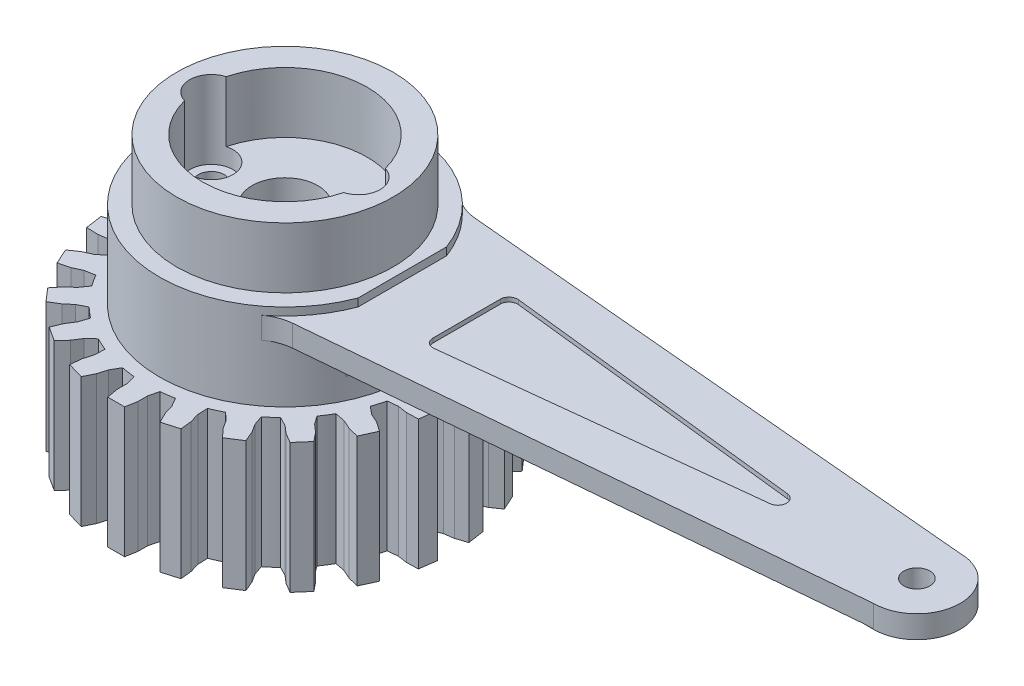
from build123d import *

# Parameters (mm, degrees)
SKETCH1_R            = 14.5
BOSS_EXTRUDE1_DEPTH  = 2
SKETCH2_R            = 3.8
SKETCH2_R_2          = 1.5
CUT_EXTRUDE1_DEPTH   = 2.5
BOSS_EXTRUDE2_START  = 7
SKETCH3_R            = 14.5
SKETCH3_R_2          = 12.5
BOSS_EXTRUDE2_DEPTH  = 7
BOSS_EXTRUDE3_START  = 1
SKETCH4_R            = 14.5
SKETCH4_R_2          = 3.8
SKETCH4_R_3          = 1.5
BOSS_EXTRUDE3_DEPTH  = 1
SKETCH5_R            = 2.6
SKETCH5_R_2          = 2.5
CUT_EXTRUDE2_DEPTH   = 2
BOSS_EXTRUDE4_START  = -3.5
SKETCH6_R            = 1.5
BOSS_EXTRUDE4_DEPTH  = 3.5
BOSS_EXTRUDE5_START  = 30
SKETCH9_R            = 12.5
BOSS_EXTRUDE5_DEPTH  = 30
SKETCH15_R           = 12.5
SKETCH15_R_2         = 9.5
BOSS_EXTRUDE9_DEPTH  = 7
SKETCH17_R           = 2.5
CUT_EXTRUDE5_DEPTH   = 7
SKETCH18_W           = 71.644805376
SKETCH18_H           = 13.532805393
CUT_EXTRUDE6_DEPTH   = 0.9
SKETCH19_W           = 61.579455678
SKETCH19_H           = 54.934190677
CUT_EXTRUDE7_DEPTH   = 15
BOSS_EXTRUDE14_START = -2.5
BOSS_EXTRUDE14_DEPTH = 2.5
FILLET2_R            = 5
SKETCH21_W           = 41.145247831
SKETCH21_H           = 10
BOSS_EXTRUDE15_DEPTH = 4
CUT_EXTRUDE8_DEPTH   = 17
FILLET5_R            = 2
CUT_EXTRUDE9_DEPTH   = 0.5
FILLET6_R            = 1


with BuildPart() as part:
    # Sketch1 → Boss-Extrude1 (new body)
    with BuildSketch(Plane(origin=(0, 0, 0), x_dir=(1, 0, 0), z_dir=(0, 1, 0))):
        Circle(SKETCH1_R)
    extrude(amount=BOSS_EXTRUDE1_DEPTH)

    # Sketch2 → Cut-Extrude1 (cut)
    with BuildSketch(Plane(origin=(0, 2, 0), x_dir=(1, 0, 0), z_dir=(0, 1, 0))):
        Circle(SKETCH2_R)
        with Locations((-8.5, 0)):
            Circle(SKETCH2_R_2)
        with Locations((8.5, 0)):
            Circle(SKETCH2_R_2)
    extrude(amount=-CUT_EXTRUDE1_DEPTH, mode=Mode.SUBTRACT)

    # Sketch3 → Boss-Extrude2 (add)
    with BuildSketch(Plane.XZ.offset(BOSS_EXTRUDE2_START)):
        Circle(SKETCH3_R)
        Circle(SKETCH3_R_2, mode=Mode.SUBTRACT)
    extrude(amount=-BOSS_EXTRUDE2_DEPTH)

    # Sketch4 → Boss-Extrude3 (add)
    with BuildSketch(Plane(origin=(0, 2, 0), x_dir=(1, 0, 0), z_dir=(0, 1, 0)).offset(BOSS_EXTRUDE3_START)):
        Circle(SKETCH4_R)
        Circle(SKETCH4_R_2, mode=Mode.SUBTRACT)
        with Locations((8.5, 0)):
            Circle(SKETCH4_R_3, mode=Mode.SUBTRACT)
        with Locations((-8.5, 0)):
            Circle(SKETCH4_R_3, mode=Mode.SUBTRACT)
    extrude(amount=-BOSS_EXTRUDE3_DEPTH)

    # Sketch5 → Cut-Extrude2 (cut)
    with BuildSketch(Plane(origin=(0, 3, 0), x_dir=(1, 0, 0), z_dir=(0, 1, 0))):
        with Locations((8.5, 0)):
            Circle(SKETCH5_R)
        with Locations((-8.5, 0)):
            Circle(SKETCH5_R_2)
    extrude(amount=-CUT_EXTRUDE2_DEPTH, mode=Mode.SUBTRACT)

    # Sketch6 → Boss-Extrude4 (add)
    with BuildSketch(Plane(origin=(0, 3, 0), x_dir=(1, 0, 0), z_dir=(0, 1, 0)).offset(BOSS_EXTRUDE4_START)):
        with BuildLine():
            Line((70, 5), (60, 5))
            Line((60, 5), (13.610657589, 5))
            ThreePointArc((13.610657589, 5), (14.275933158, 2.539238563), (14.5, 0))
            ThreePointArc((14.5, 0), (14.275933158, -2.539238563), (13.610657589, -5))
            Line((13.610657589, -5), (60, -5))
            Line((60, -5), (70, -5))
            Line((70, -5), (73, -5))
            ThreePointArc((73, -5), (78, 0), (73, 5))
            Line((73, 5), (70, 5))
        make_face()
        with Locations((73, 0)):
            Circle(SKETCH6_R, mode=Mode.SUBTRACT)
    extrude(amount=BOSS_EXTRUDE4_DEPTH)

    # Sketch9 → Boss-Extrude5 (add)
    with BuildSketch(Plane(origin=(0, -7, 0), x_dir=(-1, 0, 0), z_dir=(0, -1, 0)).offset(BOSS_EXTRUDE5_START)):
        with BuildLine():
            Line((0.977254255, 19.494569665), (-0.977254255, 19.494569665))
            Line((-0.977254255, 19.494569665), (-1.208206331, 18.184775353))
            Line((-1.208206331, 18.184775353), (-1.208206331, 17.065775353))
            Line((-1.208206331, 17.065775353), (-1.493190324, 15.922766988))
            ThreePointArc((-1.493190324, 15.922766988), (-2.275988159, 15.82984535), (-3.053256231, 15.698463373))
            Line((-3.053256231, 15.698463373), (-3.648719039, 16.7148826))
            Line((-3.648719039, 16.7148826), (-3.96397777, 17.788555237))
            Line((-3.96397777, 17.788555237), (-4.554586365, 18.980226957))
            Line((-4.554586365, 18.980226957), (-6.429923547, 18.429578277))
            Line((-6.429923547, 18.429578277), (-6.282508741, 17.107773119))
            Line((-6.282508741, 17.107773119), (-5.96725001, 16.034100482))
            Line((-5.96725001, 16.034100482), (-5.91866748, 14.857102717))
            ThreePointArc((-5.91866748, 14.857102717), (-6.643577451, 14.547405423), (-7.352346125, 14.202363618))
            Line((-7.352346125, 14.202363618), (-8.210046893, 15.009849465))
            Line((-8.210046893, 15.009849465), (-8.815023968, 15.951212168))
            Line((-8.815023968, 15.951212168), (-9.717441485, 16.928219141))
            Line((-9.717441485, 16.928219141), (-11.361678674, 15.871532062))
            Line((-11.361678674, 15.871532062), (-10.847839657, 14.644800851))
            Line((-10.847839657, 14.644800851), (-10.242862582, 13.703438148))
            Line((-10.242862582, 13.703438148), (-9.864649396, 12.587804343))
            ThreePointArc((-9.864649396, 12.587804343), (-10.472943609, 12.086421226), (-11.055792662, 11.555672828))
            Line((-11.055792662, 11.555672828), (-12.106245574, 12.088807594))
            Line((-12.106245574, 12.088807594), (-12.951929348, 12.821596755))
            Line((-12.951929348, 12.821596755), (-14.093047288, 13.504787686))
            Line((-14.093047288, 13.504787686), (-15.372978165, 12.027668711))
            Line((-15.372978165, 12.027668711), (-14.534343118, 10.995393914))
            Line((-14.534343118, 10.995393914), (-13.688659344, 10.262604753))
            Line((-13.688659344, 10.262604753), (-13.011456085, 9.298716924))
            ThreePointArc((-13.011456085, 9.298716924), (-13.453854161, 8.646267062), (-13.863564629, 7.972810149))
            Line((-13.863564629, 7.972810149), (-15.021668238, 8.188402426))
            Line((-15.021668238, 8.188402426), (-16.039546441, 8.653251826))
            Line((-16.039546441, 8.653251826), (-17.326918214, 8.987278649))
            Line((-17.326918214, 8.987278649), (-18.138850392, 7.209395173))
            Line((-18.138850392, 7.209395173), (-17.043360539, 6.455205554))
            Line((-17.043360539, 6.455205554), (-16.025482336, 5.990356154))
            Line((-16.025482336, 5.990356154), (-15.104151985, 5.256302761))
            ThreePointArc((-15.104151985, 5.256302761), (-15.344813462, 4.505643762), (-15.548193039, 3.744037809))
            Line((-15.548193039, 3.744037809), (-16.720124678, 3.624621592))
            Line((-16.720124678, 3.624621592), (-17.827734872, 3.783871896))
            Line((-17.827734872, 3.783871896), (-19.157065273, 3.741673745))
            Line((-19.157065273, 3.741673745), (-19.435220836, 1.807059313))
            Line((-19.435220836, 1.807059313), (-18.171626249, 1.39205483))
            Line((-18.171626249, 1.39205483), (-17.064016056, 1.232804526))
            Line((-17.064016056, 1.232804526), (-15.973199318, 0.788054209))
            ThreePointArc((-15.973199318, 0.788054209), (-15.992627235, 0), (-15.973199318, -0.788054209))
            Line((-15.973199318, -0.788054209), (-17.064016056, -1.232804526))
            Line((-17.064016056, -1.232804526), (-18.171626249, -1.39205483))
            Line((-18.171626249, -1.39205483), (-19.435220836, -1.807059313))
            Line((-19.435220836, -1.807059313), (-19.157065273, -3.741673745))
            Line((-19.157065273, -3.741673745), (-17.827734872, -3.783871896))
            Line((-17.827734872, -3.783871896), (-16.720124678, -3.624621592))
            Line((-16.720124678, -3.624621592), (-15.548193039, -3.744037809))
            ThreePointArc((-15.548193039, -3.744037809), (-15.344813462, -4.505643762), (-15.104151985, -5.256302761))
            Line((-15.104151985, -5.256302761), (-16.025482336, -5.990356154))
            Line((-16.025482336, -5.990356154), (-17.043360539, -6.455205554))
            Line((-17.043360539, -6.455205554), (-18.138850392, -7.209395173))
            Line((-18.138850392, -7.209395173), (-17.326918214, -8.987278649))
            Line((-17.326918214, -8.987278649), (-16.039546441, -8.653251826))
            Line((-16.039546441, -8.653251826), (-15.021668238, -8.188402426))
            Line((-15.021668238, -8.188402426), (-13.863564629, -7.972810149))
            ThreePointArc((-13.863564629, -7.972810149), (-13.453854161, -8.646267062), (-13.011456085, -9.298716924))
            Line((-13.011456085, -9.298716924), (-13.688659344, -10.262604753))
            Line((-13.688659344, -10.262604753), (-14.534343118, -10.995393914))
            Line((-14.534343118, -10.995393914), (-15.372978165, -12.027668711))
            Line((-15.372978165, -12.027668711), (-14.093047288, -13.504787686))
            Line((-14.093047288, -13.504787686), (-12.951929348, -12.821596755))
            Line((-12.951929348, -12.821596755), (-12.106245574, -12.088807594))
            Line((-12.106245574, -12.088807594), (-11.055792662, -11.555672828))
            ThreePointArc((-11.055792662, -11.555672828), (-10.472943609, -12.086421226), (-9.864649396, -12.587804343))
            Line((-9.864649396, -12.587804343), (-10.242862582, -13.703438148))
            Line((-10.242862582, -13.703438148), (-10.847839657, -14.644800851))
            Line((-10.847839657, -14.644800851), (-11.361678674, -15.871532062))
            Line((-11.361678674, -15.871532062), (-9.717441485, -16.928219141))
            Line((-9.717441485, -16.928219141), (-8.815023968, -15.951212168))
            Line((-8.815023968, -15.951212168), (-8.210046893, -15.009849465))
            Line((-8.210046893, -15.009849465), (-7.352346125, -14.202363618))
            ThreePointArc((-7.352346125, -14.202363618), (-6.643577451, -14.547405423), (-5.91866748, -14.857102717))
            Line((-5.91866748, -14.857102717), (-5.96725001, -16.034100482))
            Line((-5.96725001, -16.034100482), (-6.282508741, -17.107773119))
            Line((-6.282508741, -17.107773119), (-6.429923547, -18.429578277))
            Line((-6.429923547, -18.429578277), (-4.554586365, -18.980226957))
            Line((-4.554586365, -18.980226957), (-3.96397777, -17.788555237))
            Line((-3.96397777, -17.788555237), (-3.648719039, -16.7148826))
            Line((-3.648719039, -16.7148826), (-3.053256231, -15.698463373))
            ThreePointArc((-3.053256231, -15.698463373), (-2.275988159, -15.82984535), (-1.493190324, -15.922766988))
            Line((-1.493190324, -15.922766988), (-1.208206331, -17.065775353))
            Line((-1.208206331, -17.065775353), (-1.208206331, -18.184775353))
            Line((-1.208206331, -18.184775353), (-0.977254255, -19.494569665))
            Line((-0.977254255, -19.494569665), (0.977254255, -19.494569665))
            Line((0.977254255, -19.494569665), (1.208206331, -18.184775353))
            Line((1.208206331, -18.184775353), (1.208206331, -17.065775353))
            Line((1.208206331, -17.065775353), (1.493190324, -15.922766988))
            ThreePointArc((1.493190324, -15.922766988), (2.275988159, -15.82984535), (3.053256231, -15.698463373))
            Line((3.053256231, -15.698463373), (3.648719039, -16.7148826))
            Line((3.648719039, -16.7148826), (3.96397777, -17.788555237))
            Line((3.96397777, -17.788555237), (4.554586365, -18.980226957))
            Line((4.554586365, -18.980226957), (6.429923547, -18.429578277))
            Line((6.429923547, -18.429578277), (6.282508741, -17.107773119))
            Line((6.282508741, -17.107773119), (5.96725001, -16.034100482))
            Line((5.96725001, -16.034100482), (5.91866748, -14.857102717))
            ThreePointArc((5.91866748, -14.857102717), (6.643577451, -14.547405423), (7.352346125, -14.202363618))
            Line((7.352346125, -14.202363618), (8.210046893, -15.009849465))
            Line((8.210046893, -15.009849465), (8.815023968, -15.951212168))
            Line((8.815023968, -15.951212168), (9.717441485, -16.928219141))
            Line((9.717441485, -16.928219141), (11.361678674, -15.871532062))
            Line((11.361678674, -15.871532062), (10.847839657, -14.644800851))
            Line((10.847839657, -14.644800851), (10.242862582, -13.703438148))
            Line((10.242862582, -13.703438148), (9.864649396, -12.587804343))
            ThreePointArc((9.864649396, -12.587804343), (10.472943609, -12.086421226), (11.055792662, -11.555672828))
            Line((11.055792662, -11.555672828), (12.106245574, -12.088807594))
            Line((12.106245574, -12.088807594), (12.951929348, -12.821596755))
            Line((12.951929348, -12.821596755), (14.093047288, -13.504787686))
            Line((14.093047288, -13.504787686), (15.372978165, -12.027668711))
            Line((15.372978165, -12.027668711), (14.534343118, -10.995393914))
            Line((14.534343118, -10.995393914), (13.688659344, -10.262604753))
            Line((13.688659344, -10.262604753), (13.011456085, -9.298716924))
            ThreePointArc((13.011456085, -9.298716924), (13.453854161, -8.646267062), (13.863564629, -7.972810149))
            Line((13.863564629, -7.972810149), (15.021668238, -8.188402426))
            Line((15.021668238, -8.188402426), (16.039546441, -8.653251826))
            Line((16.039546441, -8.653251826), (17.326918214, -8.987278649))
            Line((17.326918214, -8.987278649), (18.138850392, -7.209395173))
            Line((18.138850392, -7.209395173), (17.043360539, -6.455205554))
            Line((17.043360539, -6.455205554), (16.025482336, -5.990356154))
            Line((16.025482336, -5.990356154), (15.104151985, -5.256302761))
            ThreePointArc((15.104151985, -5.256302761), (15.344813462, -4.505643762), (15.548193039, -3.744037809))
            Line((15.548193039, -3.744037809), (16.720124678, -3.624621592))
            Line((16.720124678, -3.624621592), (17.827734872, -3.783871896))
            Line((17.827734872, -3.783871896), (19.157065273, -3.741673745))
            Line((19.157065273, -3.741673745), (19.435220836, -1.807059313))
            Line((19.435220836, -1.807059313), (18.171626249, -1.39205483))
            Line((18.171626249, -1.39205483), (17.064016056, -1.232804526))
            Line((17.064016056, -1.232804526), (15.973199318, -0.788054209))
            ThreePointArc((15.973199318, -0.788054209), (15.992627235, 0), (15.973199318, 0.788054209))
            Line((15.973199318, 0.788054209), (17.064016056, 1.232804526))
            Line((17.064016056, 1.232804526), (18.171626249, 1.39205483))
            Line((18.171626249, 1.39205483), (19.435220836, 1.807059313))
            Line((19.435220836, 1.807059313), (19.157065273, 3.741673745))
            Line((19.157065273, 3.741673745), (17.827734872, 3.783871896))
            Line((17.827734872, 3.783871896), (16.720124678, 3.624621592))
            Line((16.720124678, 3.624621592), (15.548193039, 3.744037809))
            ThreePointArc((15.548193039, 3.744037809), (15.344813462, 4.505643762), (15.104151985, 5.256302761))
            Line((15.104151985, 5.256302761), (16.025482336, 5.990356154))
            Line((16.025482336, 5.990356154), (17.043360539, 6.455205554))
            Line((17.043360539, 6.455205554), (18.138850392, 7.209395173))
            Line((18.138850392, 7.209395173), (17.326918214, 8.987278649))
            Line((17.326918214, 8.987278649), (16.039546441, 8.653251826))
            Line((16.039546441, 8.653251826), (15.021668238, 8.188402426))
            Line((15.021668238, 8.188402426), (13.863564629, 7.972810149))
            ThreePointArc((13.863564629, 7.972810149), (13.453854161, 8.646267062), (13.011456085, 9.298716924))
            Line((13.011456085, 9.298716924), (13.688659344, 10.262604753))
            Line((13.688659344, 10.262604753), (14.534343118, 10.995393914))
            Line((14.534343118, 10.995393914), (15.372978165, 12.027668711))
            Line((15.372978165, 12.027668711), (14.093047288, 13.504787686))
            Line((14.093047288, 13.504787686), (12.951929348, 12.821596755))
            Line((12.951929348, 12.821596755), (12.106245574, 12.088807594))
            Line((12.106245574, 12.088807594), (11.055792662, 11.555672828))
            ThreePointArc((11.055792662, 11.555672828), (10.472943609, 12.086421226), (9.864649396, 12.587804343))
            Line((9.864649396, 12.587804343), (10.242862582, 13.703438148))
            Line((10.242862582, 13.703438148), (10.847839657, 14.644800851))
            Line((10.847839657, 14.644800851), (11.361678674, 15.871532062))
            Line((11.361678674, 15.871532062), (9.717441485, 16.928219141))
            Line((9.717441485, 16.928219141), (8.815023968, 15.951212168))
            Line((8.815023968, 15.951212168), (8.210046893, 15.009849465))
            Line((8.210046893, 15.009849465), (7.352346125, 14.202363618))
            ThreePointArc((7.352346125, 14.202363618), (6.643577451, 14.547405423), (5.91866748, 14.857102717))
            Line((5.91866748, 14.857102717), (5.96725001, 16.034100482))
            Line((5.96725001, 16.034100482), (6.282508741, 17.107773119))
            Line((6.282508741, 17.107773119), (6.429923547, 18.429578277))
            Line((6.429923547, 18.429578277), (4.554586365, 18.980226957))
            Line((4.554586365, 18.980226957), (3.96397777, 17.788555237))
            Line((3.96397777, 17.788555237), (3.648719039, 16.7148826))
            Line((3.648719039, 16.7148826), (3.053256231, 15.698463373))
            ThreePointArc((3.053256231, 15.698463373), (2.275988159, 15.82984535), (1.493190324, 15.922766988))
            Line((1.493190324, 15.922766988), (1.208206331, 17.065775353))
            Line((1.208206331, 17.065775353), (1.208206331, 18.184775353))
            Line((1.208206331, 18.184775353), (0.977254255, 19.494569665))
        make_face()
        Circle(SKETCH9_R, mode=Mode.SUBTRACT)
    extrude(amount=-BOSS_EXTRUDE5_DEPTH)

    # Sketch15 → Boss-Extrude9 (add)
    with BuildSketch(Plane(origin=(0, 3, 0), x_dir=(1, 0, 0), z_dir=(0, 1, 0))):
        Circle(SKETCH15_R)
        Circle(SKETCH15_R_2, mode=Mode.SUBTRACT)
    extrude(amount=BOSS_EXTRUDE9_DEPTH)

    # Sketch17 → Cut-Extrude5 (cut)
    with BuildSketch(Plane(origin=(0, 10, 0), x_dir=(1, 0, 0), z_dir=(0, 1, 0))):
        with Locations((-8.5, 0)):
            Circle(SKETCH17_R)
        with Locations((8.5, 0)):
            Circle(SKETCH17_R)
    extrude(amount=-CUT_EXTRUDE5_DEPTH, mode=Mode.SUBTRACT)

    # Sketch18 → Cut-Extrude6 (cut)
    with BuildSketch(Plane(origin=(0, 3, 0), x_dir=(1, 0, 0), z_dir=(0, 1, 0))):
        with Locations((49.390967321, 0.047988672)):
            Rectangle(SKETCH18_W, SKETCH18_H)
    extrude(amount=-CUT_EXTRUDE6_DEPTH, mode=Mode.SUBTRACT)

    # Sketch19 → Cut-Extrude7 (cut)
    with BuildSketch(Plane.XZ.offset(37)):
        with Locations((0.59699566, 2.52896314)):
            Rectangle(SKETCH19_W, SKETCH19_H)
    extrude(amount=-CUT_EXTRUDE7_DEPTH, mode=Mode.SUBTRACT)

    # Sketch20 → Boss-Extrude14 (add)
    with BuildSketch(Plane(origin=(0, 2.1, 0), x_dir=(1, 0, 0), z_dir=(0, 1, 0)).offset(BOSS_EXTRUDE14_START)):
        with BuildLine():
            Line((73, 5), (9.826262276, 10.662765574))
            ThreePointArc((9.826262276, 10.662765574), (12.022025927, 8.106842333), (13.568564633, 5.113125638))
            Line((13.568564633, 5.113125638), (13.568564633, 4.679970228))
            Line((13.568564633, 4.679970228), (73, 5))
        make_face()
        with BuildLine():
            Line((73, -5), (13.568564633, -4.679970228))
            Line((13.568564633, -4.679970228), (13.568564633, -5.113125638))
            ThreePointArc((13.568564633, -5.113125638), (12.022025927, -8.106842333), (9.826262276, -10.662765574))
            Line((9.826262276, -10.662765574), (73, -5))
        make_face()
    extrude(amount=BOSS_EXTRUDE14_DEPTH)

    # Fillet2
    fillet2_edges = [part.edges().sort_by_distance(p)[0] for p in [
        (9.826262276, 0.85, -10.662765574),
        (9.826262276, 0.85, 10.662765574),
    ]]
    fillet(fillet2_edges, radius=FILLET2_R)

    # Sketch21 → Boss-Extrude15 (add)
    with BuildSketch(Plane.XZ.offset(0.5)):
        with Locations((34.183281505, 0)):
            Rectangle(SKETCH21_W, SKETCH21_H)
    extrude(amount=BOSS_EXTRUDE15_DEPTH)

    # Sketch22 → Cut-Extrude8 (cut)
    with BuildSketch(Plane.XY.offset(5)):
        Polygon((13.610657589, -4.5), (54.75590542, -0.5), (54.75590542, -4.5), align=None)
    extrude(amount=-CUT_EXTRUDE8_DEPTH, mode=Mode.SUBTRACT)

    # Fillet5
    fillet5_edges = [part.edges().sort_by_distance(p)[0] for p in [
        (13.610657589, -2.45, 5),
        (13.610657589, -2.45, -5),
    ]]
    fillet(fillet5_edges, radius=FILLET5_R)

    # Sketch23 → Cut-Extrude9 (cut)
    with BuildSketch(Plane(origin=(0, 2.1, 0), x_dir=(1, 0, 0), z_dir=(0, 1, 0))):
        Polygon((21, 5), (21, -5), (66, 0), align=None)
    extrude(amount=-CUT_EXTRUDE9_DEPTH, mode=Mode.SUBTRACT)

    # Fillet6
    fillet6_edges = [part.edges().sort_by_distance(p)[0] for p in [
        (21, 1.85, 5),
        (21, 1.85, -5),
        (66, 1.85, 0),
    ]]
    fillet(fillet6_edges, radius=FILLET6_R)


solid = part.part
